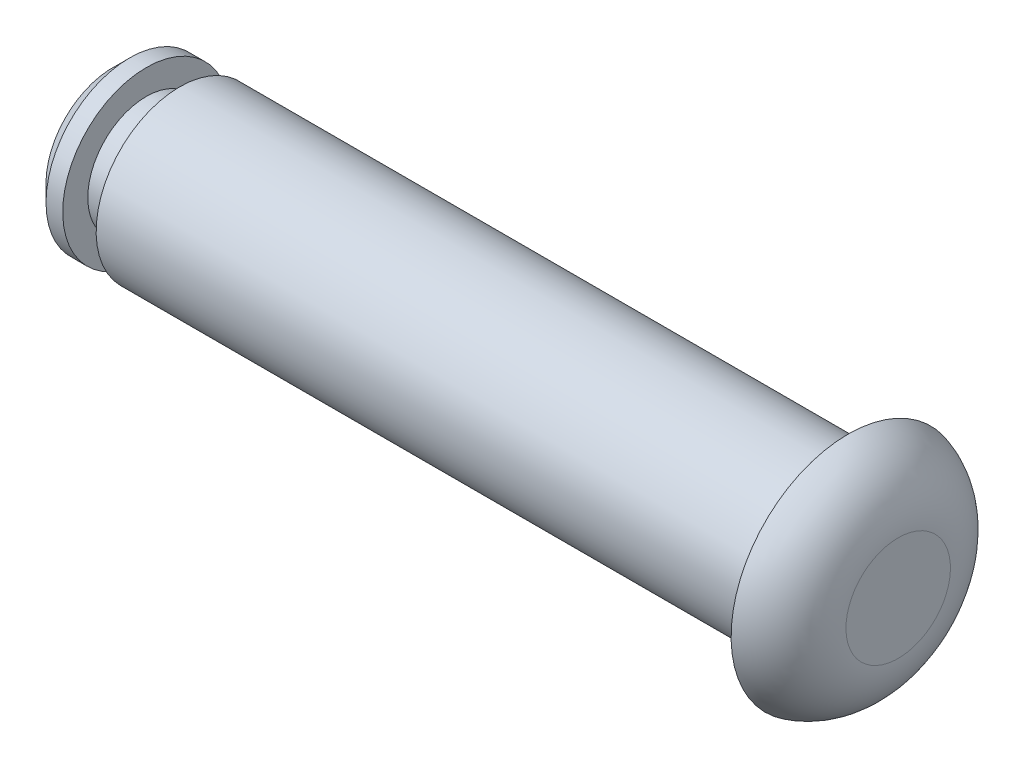
from build123d import *

# Parameters (mm, degrees)
FILLET1_R     = 2
CHAMFER1_SIZE = 0.5


with BuildPart() as part:
    # Sketch1 → Revolve1 (revolve)
    with BuildSketch(Plane.XY):
        Polygon((0, 0), (0, 2.5), (1, 2.5), (1, 1.75), (2, 1.75), (2, 2.5), (22, 2.5), (22, 3.5), (23.5, 3.5), (23.5, 0), align=None)
    revolve(axis=Axis((23.5, 0, 0), (-1, 0, 0)))

    # Fillet1
    # the kernel refuses this fillet: 2 mm, written as the material it takes off along each edge
    with BuildSketch(Plane(origin=(23.5, 0, 0), x_dir=(0, 1, 0), z_dir=(0, 0, 1))) as fillet1_piece_1:
        with BuildLine():
            CenterArc((1.563508327, 2), FILLET1_R, 270, 75.522487814)
            Line((1.563508327, 0), (1.563508327, -0.04))
            Line((1.563508327, -0.04), (3.5, -0.04))
            Line((3.5, -0.04), (3.54, 0))
            ThreePointArc((3.54, 0), (3.54, 0.75), (3.538729833, 1.49))
            Line((3.538729833, 1.49), (3.5, 1.5))
        make_face()
    revolve(axis=Axis((23.5, 0, 0), (-1, 0, 0)), mode=Mode.SUBTRACT)

    # Chamfer1
    chamfer1_edges = [part.edges().sort_by_distance(p)[0] for p in [
        (0, -2.5, 0),
    ]]
    chamfer(chamfer1_edges, length=CHAMFER1_SIZE)


solid = part.part
